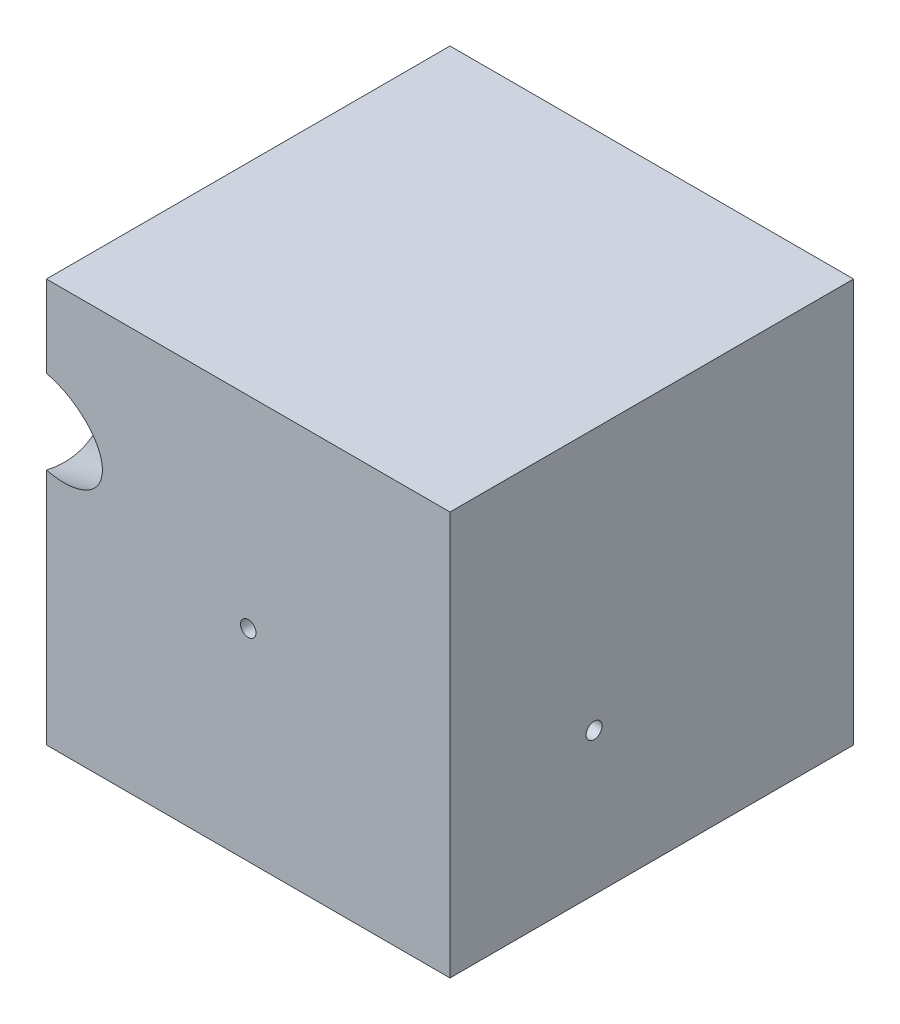
from build123d import *

# Parameters (mm, degrees)
SQUARE_W             = 52
SQUARE_H             = 52
CUBE_EXTRUSION_DEPTH = 52
STICK_CUT_START      = 15
STICK_HOLE_R         = 5.1
STICK_CUT_DEPTH      = 90.048032459
SKETCH12_R           = 1
CUT_EXTRUDE8_DEPTH   = 12
CUT_EXTRUDE9_START   = -12
SKETCH13_R           = 1
CUT_EXTRUDE9_DEPTH   = 12
SKETCH14_R           = 1
CUT_EXTRUDE10_DEPTH  = 12
SKETCH15_R           = 1.030667793
CUT_EXTRUDE11_DEPTH  = 12
SKETCH16_R           = 1
CUT_EXTRUDE12_DEPTH  = 12


with BuildPart() as part:
    # Square → Cube-Extrusion (new body)
    with BuildSketch(Plane.XY):
        Rectangle(SQUARE_W, SQUARE_H)
    extrude(amount=CUBE_EXTRUSION_DEPTH)

    # Stick-Hole → Stick-Cut (cut, through all)
    with BuildSketch(Plane(origin=(-28.888888889, 14.444444444, 28.888888889), x_dir=(-0.7453559924999299, -0.2981423969999719, -0.596284793999944), z_dir=(0.6666666666666667, -0.3333333333333332, -0.6666666666666667)).offset(STICK_CUT_START)):
        with Locations((-14.635839315, -14.230249471)):
            Circle(STICK_HOLE_R)
    extrude(amount=-STICK_CUT_DEPTH, mode=Mode.SUBTRACT)

    # Sketch12 → Cut-Extrude8 (cut)
    with BuildSketch(Plane.XY.offset(52)):
        Circle(SKETCH12_R)
    extrude(amount=-CUT_EXTRUDE8_DEPTH, mode=Mode.SUBTRACT)

    # Sketch13 → Cut-Extrude9 (cut)
    with BuildSketch(Plane(origin=(0, 0, 0), x_dir=(-1, 0, 0), z_dir=(0, 0, -1)).offset(CUT_EXTRUDE9_START)):
        Circle(SKETCH13_R)
    extrude(amount=CUT_EXTRUDE9_DEPTH, mode=Mode.SUBTRACT)

    # Sketch14 → Cut-Extrude10 (cut)
    with BuildSketch(Plane.ZY.offset(26)):
        with Locations((10.514408983, 15.48249327)):
            Circle(SKETCH14_R)
        with Locations((20.449310987, -13.814590013)):
            Circle(SKETCH14_R)
    extrude(amount=-CUT_EXTRUDE10_DEPTH, mode=Mode.SUBTRACT)

    # Sketch15 → Cut-Extrude11 (cut)
    with BuildSketch(Plane(origin=(26, 0, 0), x_dir=(0, 0, -1), z_dir=(1, 0, 0))):
        with Locations((-33.439884797, -7.650599719)):
            Circle(SKETCH15_R)
    extrude(amount=-CUT_EXTRUDE11_DEPTH, mode=Mode.SUBTRACT)

    # Sketch16 → Cut-Extrude12 (cut)
    with BuildSketch(Plane.XZ.offset(26)):
        with Locations((-9, 44.28)):
            Circle(SKETCH16_R)
    extrude(amount=-CUT_EXTRUDE12_DEPTH, mode=Mode.SUBTRACT)


solid = part.part
